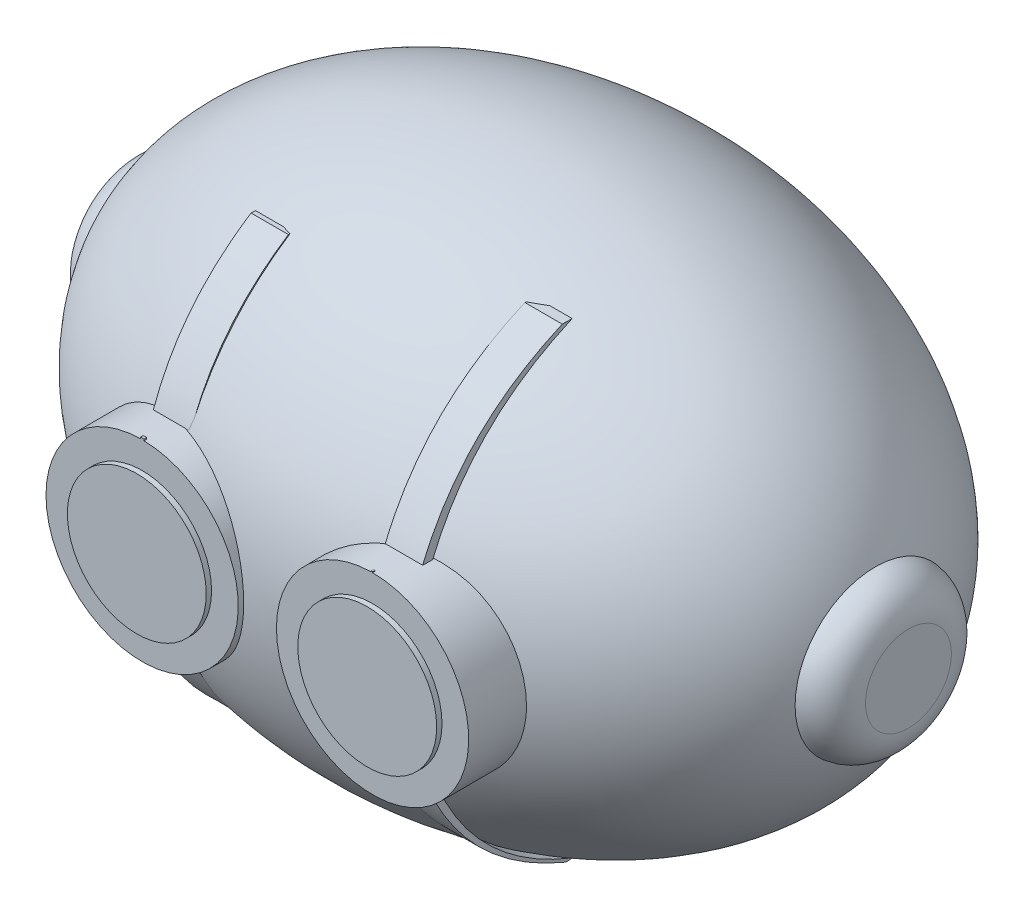
from build123d import *

# Parameters (mm, degrees)
CROQUIS2_R                   = 18
SALIENTE_EXTRUIR1_DEPTH      = 51
CROQUIS3_R                   = 13
SALIENTE_EXTRUIR2_DEPTH      = 1
CROQUIS4_W                   = 0.658437432
CROQUIS4_H                   = 0.282223892
CROQUIS4_W_2                 = 0.320004246
CROQUIS4_H_2                 = 0.141396635
SALIENTE_EXTRUIR3_DEPTH      = 0.5
SALIENTE_EXTRUIR4_DEPTH      = 3.5
SALIENTE_EXTRUIR4_DEPTH_BACK = 3.5
SALIENTE_EXTRUIR5_DEPTH      = 3.5
SALIENTE_EXTRUIR5_DEPTH_BACK = 3.5
SALIENTE_EXTRUIR6_START      = -73
SALIENTE_EXTRUIR6_OUTLINE_R  = 15
SALIENTE_EXTRUIR6_DEPTH      = 146
REDONDEO1_R                  = 7


with BuildPart() as part:
    # Croquis1 → Revolución1 (revolve)
    with BuildSketch(Plane.XY):
        with BuildLine():
            Line((-70, 0), (70, 0))
            add(Edge.make_bspline(
                [(70, 0), (70, 50), (0, 50), (-70, 50), (-70, 0)],
                knots=[0, 0, 0, 1.570796327, 1.570796327, 3.141592654, 3.141592654, 3.141592654], degree=2, weights=[1, 0.707106781, 1, 0.707106781, 1]))
        make_face()
    revolve(axis=Axis((-70, 0, 0), (1, 0, 0)))

    # Croquis2 → Saliente-Extruir1 (add)
    with BuildSketch(Plane.XY):
        with Locations(Location((-19.487902233, 0, 0), (0, 0, 180))):
            Circle(CROQUIS2_R)
        with Locations(Location((23.660103021, 0, 0), (0, 0, 180))):
            Circle(CROQUIS2_R)
    extrude(amount=SALIENTE_EXTRUIR1_DEPTH)

    # Croquis3 → Saliente-Extruir2 (add)
    with BuildSketch(Plane.XY.offset(51)):
        with Locations((-19.487902233, 0)):
            Circle(CROQUIS3_R)
        with Locations((23.660103021, 0)):
            Circle(CROQUIS3_R)
    extrude(amount=SALIENTE_EXTRUIR2_DEPTH)

    # Croquis4 → Saliente-Extruir3 (add)
    with BuildSketch(Plane.XY.offset(51)):
        with Locations((-19.454086515, 18.138687812)):
            Rectangle(CROQUIS4_W, CROQUIS4_H)
        with Locations((23.500100898, 18.067853573)):
            Rectangle(CROQUIS4_W_2, CROQUIS4_H_2)
    extrude(amount=-SALIENTE_EXTRUIR3_DEPTH)

    # Croquis5 → Saliente-Extruir4 (add, two sides: drawn at the far end of the back side and taken through both)
    with BuildSketch(Plane.ZY.offset(19.783305231).offset(-SALIENTE_EXTRUIR4_DEPTH_BACK)):
        with BuildLine():
            Line((45.102786998, 17.99284484), (44.264151626, 17.960984123))
            add(Edge.make_bspline(
                [(44.264151626, 17.960984123), (39.195779223, 32.174765476), (25.968082753, 40.729542846)],
                knots=[0, 0, 0, 1, 1, 1], degree=2))
            Line((25.968082753, 40.729542846), (26.806718126, 40.761403564))
            add(Edge.make_bspline(
                [(45.102786998, 17.99284484), (40.034414596, 32.206626193), (26.806718126, 40.761403564)],
                knots=[0, 0, 0, 1, 1, 1], degree=2))
        make_face()
        with BuildLine():
            Line((44.05198679, -17.863242496), (45.324226475, -17.99117012))
            add(Edge.make_bspline(
                [(45.324226475, -17.99117012), (38.741361208, -33.553243491), (23.362469949, -41.872818185)],
                knots=[0, 0, 0, 1, 1, 1], degree=2))
            Line((23.362469949, -41.872818185), (22.310001344, -41.766989221))
            add(Edge.make_bspline(
                [(44.05198679, -17.863242496), (37.825509818, -33.569740794), (22.310001344, -41.766989221)],
                knots=[0, 0, 0, 1, 1, 1], degree=2))
        make_face()
    extrude(amount=SALIENTE_EXTRUIR4_DEPTH + SALIENTE_EXTRUIR4_DEPTH_BACK)

    # Croquis7 → Saliente-Extruir5 (add, two sides: drawn at the far end of the back side and taken through both)
    with BuildSketch(Plane(origin=(23.660103021, 0, 0), x_dir=(0, 0, -1), z_dir=(1, 0, 0)).offset(-SALIENTE_EXTRUIR5_DEPTH_BACK)):
        with BuildLine():
            Line((-45.120061105, 18.019442278), (-43.250475738, 17.98062702))
            add(Edge.make_bspline(
                [(-43.250475738, 17.98062702), (-35.891813628, 35.880623933), (-17.114046962, 44.01536182)],
                knots=[0, 0, 0, 1, 1, 1], degree=2))
            Line((-17.114046962, 44.01536182), (-18.983632328, 44.054177079))
            add(Edge.make_bspline(
                [(-45.120061105, 18.019442278), (-37.761398995, 35.919439192), (-18.983632328, 44.054177079)],
                knots=[0, 0, 0, 1, 1, 1], degree=2))
        make_face()
        with BuildLine():
            Line((-44.432847426, -17.993871008), (-42.912701213, -17.875236037))
            add(Edge.make_bspline(
                [(-42.912701213, -17.875236037), (-35.938106309, -35.95704751), (-17.114046962, -43.450193367)],
                knots=[0, 0, 0, 1, 1, 1], degree=2))
            Line((-17.114046962, -43.450193367), (-18.290284577, -43.541989086))
            add(Edge.make_bspline(
                [(-44.432847426, -17.993871008), (-36.938752852, -35.868409629), (-18.290284577, -43.541989086)],
                knots=[0, 0, 0, 1, 1, 1], degree=2))
        make_face()
    extrude(amount=SALIENTE_EXTRUIR5_DEPTH + SALIENTE_EXTRUIR5_DEPTH_BACK)

    # Saliente-Extruir6: read off the stored shape, not the designer's step
    # Saliente-Extruir6 outline → Saliente-Extruir6 (add)
    with BuildSketch(Plane(origin=(0, 0, 0), x_dir=(0, 0, -1), z_dir=(1, 0, 0)).offset(SALIENTE_EXTRUIR6_START)):
        Circle(SALIENTE_EXTRUIR6_OUTLINE_R)
    extrude(amount=SALIENTE_EXTRUIR6_DEPTH)

    # Redondeo1
    # the kernel refuses this fillet: 7 mm, written as the material it takes off along each edge
    with BuildSketch(Plane(origin=(-73, 0, 0), x_dir=(0, 0, -1), z_dir=(0, -1, 0))) as redondeo1_piece_1:
        with BuildLine():
            CenterArc((8.043116996, 7), REDONDEO1_R, 270, 83.637379118)
            Line((8.043116996, 0), (8.043116996, -0.14))
            Line((8.043116996, -0.14), (15, -0.14))
            Line((15, -0.14), (15.14, 0))
            ThreePointArc((15.14, 0), (15.14, 3.11212795), (15.139137658, 6.208741019))
            Line((15.139137658, 6.208741019), (14.999999998, 6.224255901))
        make_face()
    revolve(axis=Axis((-73, 0, 0), (1, 0, 0)), mode=Mode.SUBTRACT)
    with BuildSketch(Plane(origin=(73, 0, 0), x_dir=(0, 0, -1), z_dir=(0, -1, 0))) as redondeo1_piece_2:
        with BuildLine():
            CenterArc((8.043117004, -7), REDONDEO1_R, 6.362620882, 83.637379118)
            Line((8.043117004, 0), (8.043117004, 0.14))
            Line((8.043117004, 0.14), (15, 0.14))
            Line((15, 0.14), (15.14, 0))
            ThreePointArc((15.14, 0), (15.14, -3.11212795), (15.139137665, -6.208741019))
            Line((15.139137665, -6.208741019), (15.000000005, -6.224255901))
        make_face()
    revolve(axis=Axis((73, 0, 0), (1, 0, 0)), mode=Mode.SUBTRACT)


solid = part.part
